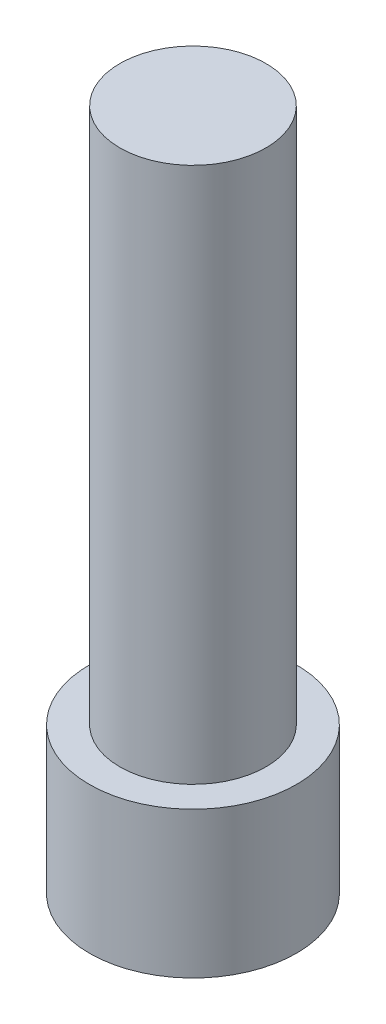
from build123d import *

# Parameters (mm, degrees)
SKETCH_1_R          = 4.25
EXTRUDE_1_DEPTH     = 6
SKETCH_2_R          = 3
EXTRUDE_2_DEPTH     = 22
CUT_EXTRUDE_1_DEPTH = 3


with BuildPart() as part:
    # 草图1 → 凸台-拉伸1 (new body)
    with BuildSketch(Plane(origin=(0, 0, 0), x_dir=(1, 0, 0), z_dir=(0, 1, 0))):
        Circle(SKETCH_1_R)
    extrude(amount=EXTRUDE_1_DEPTH)

    # 草图2 → 凸台-拉伸2 (add)
    with BuildSketch(Plane(origin=(0, 6, 0), x_dir=(1, 0, 0), z_dir=(0, 1, 0))):
        Circle(SKETCH_2_R)
    extrude(amount=EXTRUDE_2_DEPTH)

    # 草图3 → 切除-拉伸1 (cut)
    with BuildSketch(Plane.XZ):
        Polygon((2.357121757, -1.666526435), (2.621815107, 1.208064104), (0.26469335, 2.874590538), (-2.357121757, 1.666526435), (-2.621815107, -1.208064104), (-0.26469335, -2.874590538), align=None)
    extrude(amount=-CUT_EXTRUDE_1_DEPTH, mode=Mode.SUBTRACT)


solid = part.part
